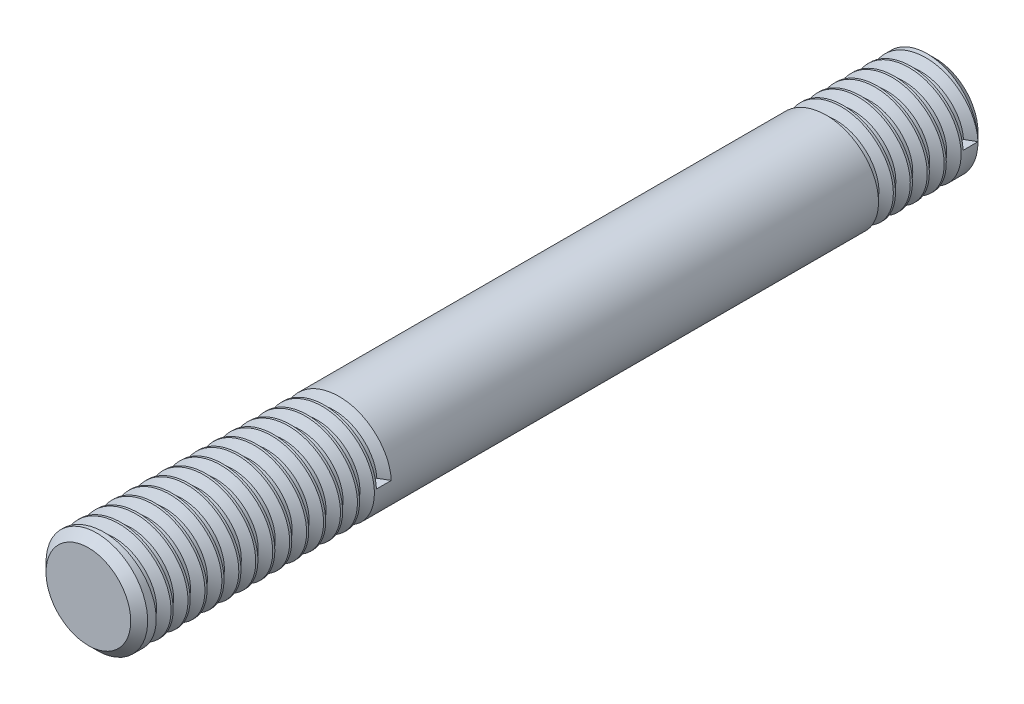
from build123d import *

# Parameters (mm, degrees)
SKETCH1_R           = 1.5
BOSS_EXTRUDE1_DEPTH = 25
CHAMFER2_SIZE       = 0.25
THREAD3_PITCH       = 0.5
THREAD4_PITCH       = 0.5


with BuildPart() as part:
    # Sketch1 → Boss-Extrude1 (new body)
    with BuildSketch(Plane.XY):
        Circle(SKETCH1_R)
    extrude(amount=BOSS_EXTRUDE1_DEPTH)

    # Chamfer2
    chamfer2_edges = [part.edges().sort_by_distance(p)[0] for p in [
        (-1.5, 0, 0),
        (-1.5, 0, 25),
    ]]
    chamfer(chamfer2_edges, length=CHAMFER2_SIZE)

    # Thread3: the profile of Thread Profile4 profile screwed along a right-hand helix of 5.5 turns, 6 arcs to a turn; built about Z, then put on its axis
    thread3_z = Axis((0, 0, 0), (0, 0, 1))
    thread3_corners = [(1.5003, 0, -0.000173205), (1.5003, 0, 0.437673204), (1.229367063, 0, 0.281249999), (1.229367063, 0, 0.156249999)]
    with BuildLine(mode=Mode.PRIVATE) as thread3_profile:
        Line(thread3_corners[0], thread3_corners[1])
        Line(thread3_corners[1], thread3_corners[2])
        Line(thread3_corners[2], thread3_corners[3])
        Line(thread3_corners[3], thread3_corners[0])
    thread3_cap = Face(thread3_profile.wire())
    thread3_turn_angles = [0, 30, 60, 90, 120, 150, 180, 210, 240, 270, 300, 330, 360]
    thread3_turn_weights = [1, 0.8660254037844387, 1, 0.8660254037844387, 1, 0.8660254037844387, 1, 0.8660254037844387, 1, 0.8660254037844387, 1, 0.8660254037844387, 1]
    thread3_turn_rails = [Edge.make_bspline([Vector(p[0], p[1], 0).rotate(thread3_z, thread3_turn_angles[k]) / thread3_turn_weights[k] + Vector(0, 0, p[2] + THREAD3_PITCH * thread3_turn_angles[k] / 360) for k in range(13)], [0, 0, 0, 1, 1, 2, 2, 3, 3, 4, 4, 5, 5, 6, 6, 6], 2, thread3_turn_weights) for p in thread3_corners]
    thread3_turn_sides = [Face.make_surface_from_curves(thread3_turn_rails[p[0]], thread3_turn_rails[p[1]]) for p in [(0, 1), (1, 2), (2, 3), (3, 0)]]
    thread3_last_angles = [1800, 1830, 1860, 1890, 1920, 1950, 1980]
    thread3_last_weights = [1, 0.8660254037844387, 1, 0.8660254037844387, 1, 0.8660254037844387, 1]
    thread3_last_rails = [Edge.make_bspline([Vector(p[0], p[1], 0).rotate(thread3_z, thread3_last_angles[k]) / thread3_last_weights[k] + Vector(0, 0, p[2] + THREAD3_PITCH * thread3_last_angles[k] / 360) for k in range(7)], [0, 0, 0, 1, 1, 2, 2, 3, 3, 3], 2, thread3_last_weights) for p in thread3_corners]
    thread3_last_sides = [Face.make_surface_from_curves(thread3_last_rails[p[0]], thread3_last_rails[p[1]]) for p in [(0, 1), (1, 2), (2, 3), (3, 0)]]
    thread3 = Plane(origin=(0, 0, 0.25), x_dir=(1, 0, 0), z_dir=(0, 0, 1)) * Solid(Shell([*[p.moved(Location((0, 0, THREAD3_PITCH * i))) for i in range(5) for p in thread3_turn_sides], *thread3_last_sides, thread3_cap, thread3_cap.rotate(thread3_z, 1980).moved(Location((0, 0, THREAD3_PITCH * 1980 / 360)))]))
    add(thread3, mode=Mode.SUBTRACT)

    # Thread4: the profile of Thread Profile5 profile screwed along a right-hand helix of 13.5 turns, 6 arcs to a turn; built about Z, then put on its axis
    thread4_z = Axis((0, 0, 0), (0, 0, 1))
    thread4_corners = [(1.5003, 0, -0.000173205), (1.5003, 0, 0.437673204), (1.229367063, 0, 0.281249999), (1.229367063, 0, 0.156249999)]
    with BuildLine(mode=Mode.PRIVATE) as thread4_profile:
        Line(thread4_corners[0], thread4_corners[1])
        Line(thread4_corners[1], thread4_corners[2])
        Line(thread4_corners[2], thread4_corners[3])
        Line(thread4_corners[3], thread4_corners[0])
    thread4_cap = Face(thread4_profile.wire())
    thread4_turn_angles = [0, 30, 60, 90, 120, 150, 180, 210, 240, 270, 300, 330, 360]
    thread4_turn_weights = [1, 0.8660254037844387, 1, 0.8660254037844387, 1, 0.8660254037844387, 1, 0.8660254037844387, 1, 0.8660254037844387, 1, 0.8660254037844387, 1]
    thread4_turn_rails = [Edge.make_bspline([Vector(p[0], p[1], 0).rotate(thread4_z, thread4_turn_angles[k]) / thread4_turn_weights[k] + Vector(0, 0, p[2] + THREAD4_PITCH * thread4_turn_angles[k] / 360) for k in range(13)], [0, 0, 0, 1, 1, 2, 2, 3, 3, 4, 4, 5, 5, 6, 6, 6], 2, thread4_turn_weights) for p in thread4_corners]
    thread4_turn_sides = [Face.make_surface_from_curves(thread4_turn_rails[p[0]], thread4_turn_rails[p[1]]) for p in [(0, 1), (1, 2), (2, 3), (3, 0)]]
    thread4_last_angles = [4680, 4710, 4740, 4770, 4800, 4830, 4860]
    thread4_last_weights = [1, 0.8660254037844387, 1, 0.8660254037844387, 1, 0.8660254037844387, 1]
    thread4_last_rails = [Edge.make_bspline([Vector(p[0], p[1], 0).rotate(thread4_z, thread4_last_angles[k]) / thread4_last_weights[k] + Vector(0, 0, p[2] + THREAD4_PITCH * thread4_last_angles[k] / 360) for k in range(7)], [0, 0, 0, 1, 1, 2, 2, 3, 3, 3], 2, thread4_last_weights) for p in thread4_corners]
    thread4_last_sides = [Face.make_surface_from_curves(thread4_last_rails[p[0]], thread4_last_rails[p[1]]) for p in [(0, 1), (1, 2), (2, 3), (3, 0)]]
    thread4 = Plane(origin=(0, 0, 24.75), x_dir=(-1, 0, 0), z_dir=(0, 0, -1)) * Solid(Shell([*[p.moved(Location((0, 0, THREAD4_PITCH * i))) for i in range(13) for p in thread4_turn_sides], *thread4_last_sides, thread4_cap, thread4_cap.rotate(thread4_z, 4860).moved(Location((0, 0, THREAD4_PITCH * 4860 / 360)))]))
    add(thread4, mode=Mode.SUBTRACT)


solid = part.part
